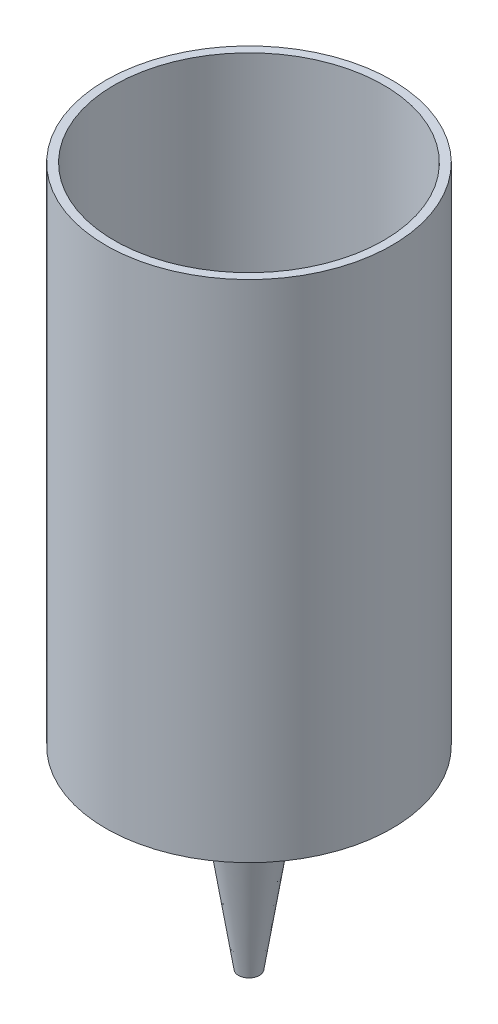
from build123d import *

# Parameters (mm, degrees)
SHELL1_T                = -1.27
CUT_EXTRUDE1_DEPTH      = 110.742992031
CUT_EXTRUDE1_DEPTH_BACK = 110.742992031
SKETCH3_R               = 1.0795


with BuildPart() as part:
    # Sketch1 → Revolve1 (revolve)
    with BuildSketch(Plane.XY):
        Polygon((0, 105.41), (-21.59, 105.41), (-21.59, 29.21), (-5.517444444, 25.4), (-1.5875, 0), (0, 0), align=None)
    revolve(axis=Axis((0, 105.41, 0), (0, -1, 0)))

    # Shell1
    shell1_openings = [part.faces().sort_by_distance(p)[0] for p in [
        (0, 105.41, 0),
    ]]
    offset(amount=SHELL1_T, openings=shell1_openings, kind=Kind.INTERSECTION)

    # Sketch3 → Cut-Extrude1 (cut, two sides: drawn at the far end of the back side and taken through both)
    with BuildSketch(Plane.XZ.offset(-CUT_EXTRUDE1_DEPTH_BACK)):
        Circle(SKETCH3_R)
    extrude(amount=CUT_EXTRUDE1_DEPTH + CUT_EXTRUDE1_DEPTH_BACK, mode=Mode.SUBTRACT)


solid = part.part
